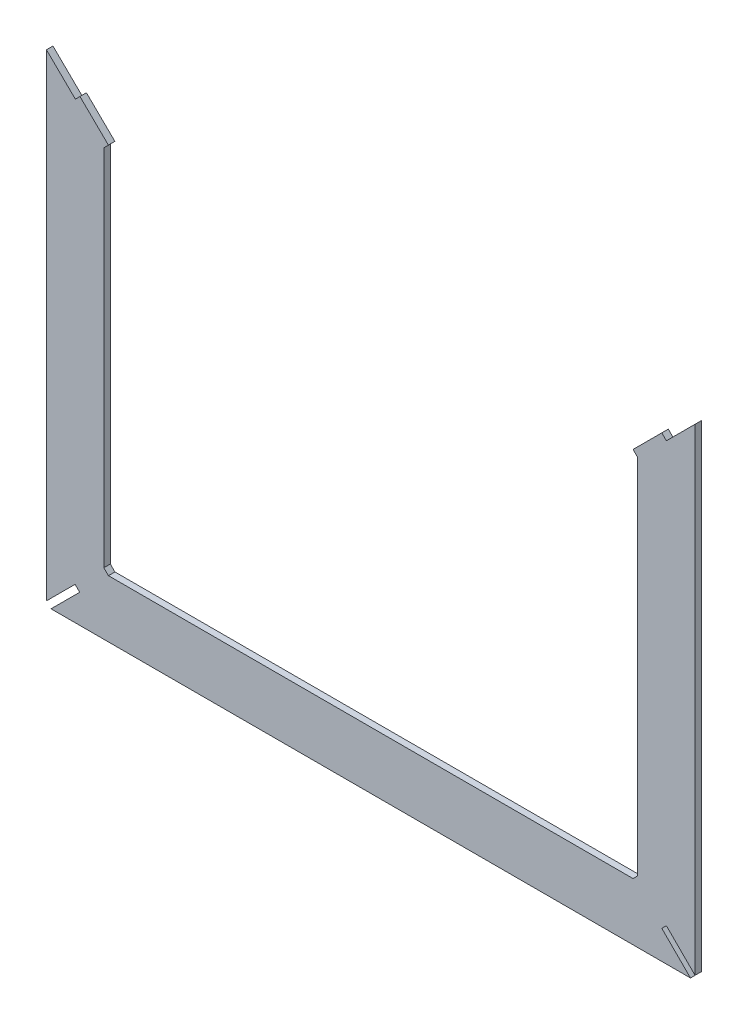
from build123d import *

# Parameters (mm, degrees)
BOSS_EXTRU_1_DEPTH = 4


with BuildPart() as part:
    # Esquisse1 → Boss.-Extru.1 (new body)
    with BuildSketch(Plane.XY):
        Polygon((-72.387865901, -137.132902491), (-69.559438777, -134.304475366), (-69.559438777, 89.238670384), (-72.387865901, 92.067097509), (-69.559438777, 94.895524634), (-54.665535431, 109.789427979), (-51.837108306, 106.961000855), (-34.159438777, 124.638670384), (-34.159438777, -169.704475366), (-51.837108306, -152.026805837), (-54.665535431, -154.855232961), (-36.987865901, -172.532902491), (-431.331011652, -172.532902491), (-413.653342122, -154.855232961), (-416.481769247, -152.026805837), (-434.159438777, -169.704475366), (-434.159438777, 124.638670384), (-416.299299039, 107.145374281), (-413.500371662, 110.002996639), (-395.9605114, 92.823401536), (-398.759438777, 89.965779178), (-398.759438777, -134.304475366), (-395.931011652, -137.132902491), align=None)
    extrude(amount=BOSS_EXTRU_1_DEPTH)


solid = part.part
